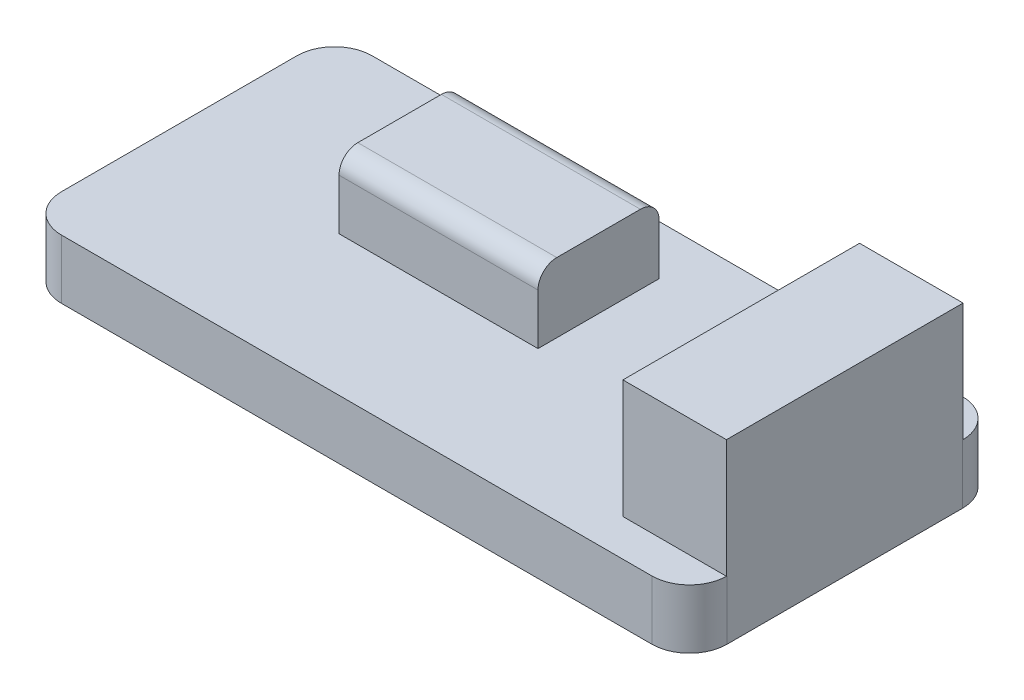
from build123d import *

# Parameters (mm, degrees)
BOSS_EXTRUDE1_DEPTH = 4
SKETCH2_W           = 7
SKETCH2_H           = 16
BOSS_EXTRUDE2_DEPTH = 8
SKETCH3_W           = 13.452288764
SKETCH3_H           = 8.193666793
BOSS_EXTRUDE3_DEPTH = 4.698
FILLET1_R           = 1.27


with BuildPart() as part:
    # Sketch1 → Boss-Extrude1 (new body)
    with BuildSketch(Plane(origin=(0, 0, 0), x_dir=(1, 0, 0), z_dir=(0, 1, 0))):
        with BuildLine():
            Line((-19.96, -10.5), (19.96, -10.5))
            ThreePointArc((19.96, -10.5), (21.756051224, -9.756051224), (22.5, -7.96))
            Line((22.5, -7.96), (22.5, 7.96))
            ThreePointArc((22.5, 7.96), (21.756051224, 9.756051224), (19.96, 10.5))
            Line((19.96, 10.5), (-19.96, 10.5))
            ThreePointArc((-19.96, 10.5), (-21.756051224, 9.756051224), (-22.5, 7.96))
            Line((-22.5, 7.96), (-22.5, -7.96))
            ThreePointArc((-22.5, -7.96), (-21.756051224, -9.756051224), (-19.96, -10.5))
        make_face()
    extrude(amount=BOSS_EXTRUDE1_DEPTH)

    # Sketch2 → Boss-Extrude2 (add)
    with BuildSketch(Plane(origin=(0, 4, 0), x_dir=(1, 0, 0), z_dir=(0, 1, 0))):
        with Locations((19, 0)):
            Rectangle(SKETCH2_W, SKETCH2_H)
    extrude(amount=BOSS_EXTRUDE2_DEPTH)

    # Sketch3 → Boss-Extrude3 (add)
    with BuildSketch(Plane(origin=(0, 4, 0), x_dir=(1, 0, 0), z_dir=(0, 1, 0))):
        with Locations((-3.928679787, 3.057338356)):
            Rectangle(SKETCH3_W, SKETCH3_H)
    extrude(amount=BOSS_EXTRUDE3_DEPTH)

    # Fillet1
    fillet1_edges = [part.edges().sort_by_distance(p)[0] for p in [
        (-3.928679787, 8.698, -7.154171752),
        (-3.928679787, 8.698, 1.039495041),
    ]]
    fillet(fillet1_edges, radius=FILLET1_R)


solid = part.part
